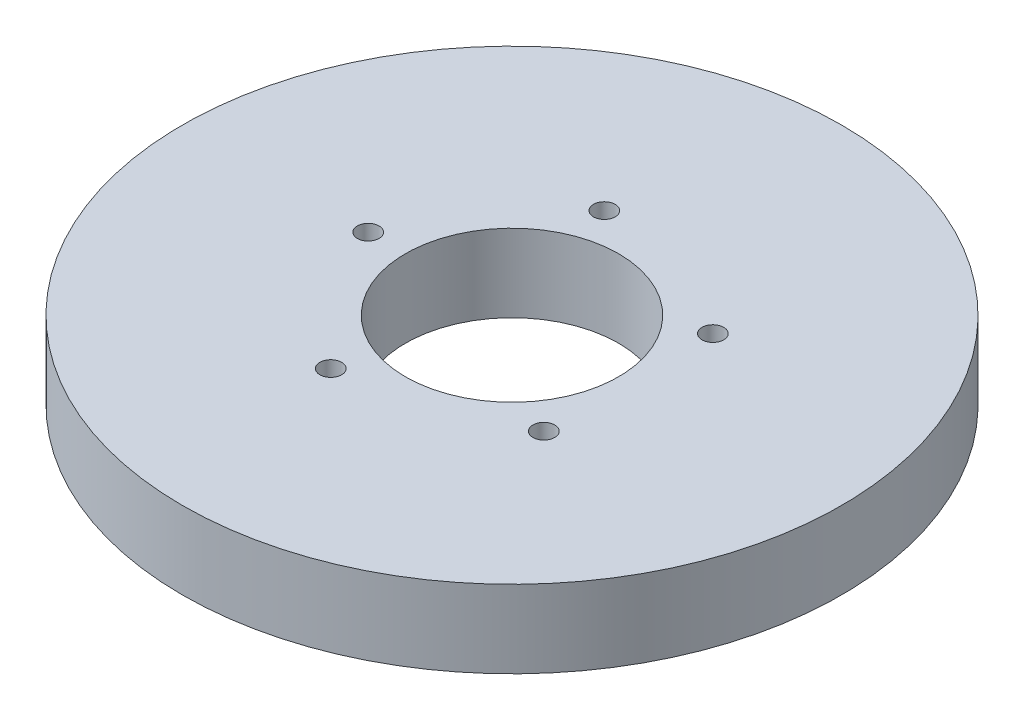
from build123d import *

# Parameters (mm, degrees)
SKETCH1_R           = 85
BOSS_EXTRUDE1_DEPTH = 20
SKETCH2_R           = 27.5
CUT_EXTRUDE1_DEPTH  = 122.86057607
SKETCH3_R           = 2.80475321
CUT_EXTRUDE2_DEPTH  = 17.664904326
CIRPATTERN1_COUNT   = 5


with BuildPart() as part:
    # Sketch1 → Boss-Extrude1 (new body)
    with BuildSketch(Plane(origin=(0, 0, 0), x_dir=(1, 0, 0), z_dir=(0, 1, 0))):
        Circle(SKETCH1_R)
    extrude(amount=BOSS_EXTRUDE1_DEPTH)

    # Sketch2 → Cut-Extrude1 (cut, through all)
    with BuildSketch(Plane(origin=(0, 0, 0), x_dir=(1, 0, 0), z_dir=(0, 1, 0))):
        Circle(SKETCH2_R)
    extrude(amount=CUT_EXTRUDE1_DEPTH, mode=Mode.SUBTRACT)

    # Sketch3 → Cut-Extrude2 (cut)
    with BuildSketch(Plane(origin=(0, 20, 0), x_dir=(1, 0, 0), z_dir=(0, 1, 0))):
        with Locations((-37.09345141, 0)):
            Circle(SKETCH3_R)
    cut_extrude2 = extrude(amount=-CUT_EXTRUDE2_DEPTH, mode=Mode.SUBTRACT)

    # CirPattern1: Cut-Extrude2 ×5 about axis
    cirpattern1_axis = Axis((0, 0, 0), (0, 1, 0))
    for i in range(1, CIRPATTERN1_COUNT):
        add(cut_extrude2.rotate(cirpattern1_axis, i * 360 / CIRPATTERN1_COUNT), mode=Mode.SUBTRACT)


solid = part.part
